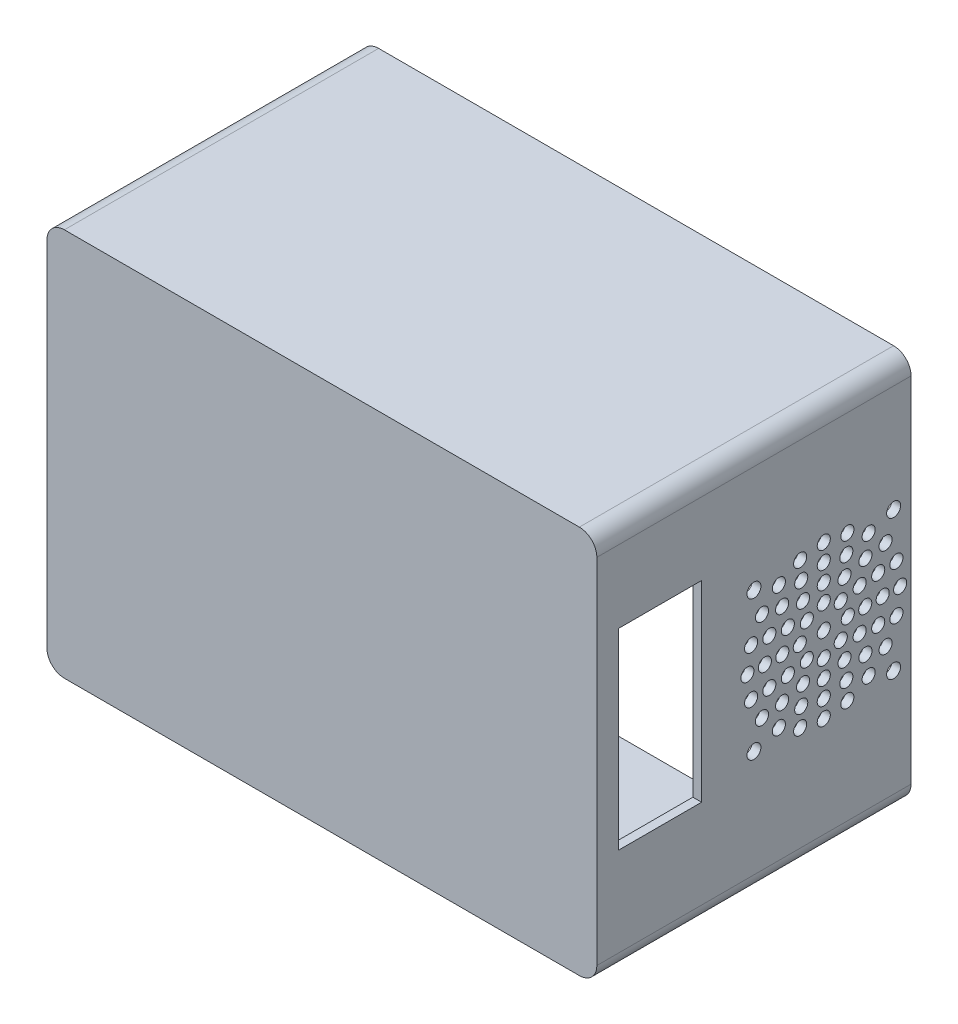
from build123d import *

# Parameters (mm, degrees)
SKETCH_1_W          = 126
SKETCH_1_H          = 89
SKETCH_1_R          = 2.15
SKETCH_1_R_2        = 2
EXTRUDE_4_DEPTH     = 70
SKETCH_3_W          = 126
SKETCH_3_H          = 89
EXTRUDE_5_DEPTH     = 2
SKETCH_4_R          = 1.6
SKETCH_4_R_2        = 1.5
CUT_EXTRUDE_1_DEPTH = 3
SKETCH_6_R          = 1.6
CUT_EXTRUDE_3_DEPTH = 2
SKETCH_8_W          = 110
SKETCH_8_H          = 22
CUT_EXTRUDE_4_DEPTH = 8
FILLET_3_R          = 4
SKETCH_9_W          = 19
SKETCH_9_H          = 44
CUT_EXTRUDE_5_DEPTH = 2
SKETCH_10_W         = 12
SKETCH_10_H         = 2
EXTRUDE_6_DEPTH     = 22


with BuildPart() as part:
    # 草图1 → 凸台-拉伸4 (new body)
    with BuildSketch(Plane.XY):
        Rectangle(SKETCH_1_W, SKETCH_1_H)
        Polygon((-4, 42.5), (-4, 36.5), (4, 36.5), (4, 42.5), (55, 42.5), (55, 36.5), (61, 36.5), (61, -36.5), (55, -36.5), (55, -42.5), (4, -42.5), (4, -36.5), (-4, -36.5), (-4, -42.5), (-55, -42.5), (-55, -36.5), (-61, -36.5), (-61, 36.5), (-55, 36.5), (-55, 42.5), align=None, mode=Mode.SUBTRACT)
        with Locations((0, 40.5)):
            Circle(SKETCH_1_R, mode=Mode.SUBTRACT)
        with Locations((-59, 40.5)):
            Circle(SKETCH_1_R, mode=Mode.SUBTRACT)
        with Locations((0, -40.5)):
            Circle(SKETCH_1_R, mode=Mode.SUBTRACT)
        with Locations((59, -40.5)):
            Circle(SKETCH_1_R, mode=Mode.SUBTRACT)
        with Locations((59, 40.5)):
            Circle(SKETCH_1_R, mode=Mode.SUBTRACT)
        with Locations((-59, -40.5)):
            Circle(SKETCH_1_R_2, mode=Mode.SUBTRACT)
    extrude(amount=EXTRUDE_4_DEPTH)

    # 草图3 → 凸台-拉伸5 (add)
    with BuildSketch(Plane.XY.offset(70)):
        Rectangle(SKETCH_3_W, SKETCH_3_H)
    extrude(amount=EXTRUDE_5_DEPTH)

    # 草图4 → 切除-拉伸1 (cut)
    with BuildSketch(Plane(origin=(63, 0, 0), x_dir=(0, 0, -1), z_dir=(1, 0, 0))):
        with Locations((-36, 16)):
            Circle(SKETCH_4_R)
        with Locations((-4, 16)):
            Circle(SKETCH_4_R)
        with Locations((-4, -16)):
            Circle(SKETCH_4_R)
        with Locations((-36, -16)):
            Circle(SKETCH_4_R)
        with Locations((-20, 17.5)):
            Circle(SKETCH_4_R_2)
        with Locations((-20, 0)):
            Circle(SKETCH_4_R_2)
        with Locations((-20, 9.5)):
            Circle(SKETCH_4_R_2)
        with Locations((-20, 13.5)):
            Circle(SKETCH_4_R_2)
        with Locations((-20, 5.5)):
            Circle(SKETCH_4_R_2)
        with Locations((-14.592202598, 16.643489035)):
            Circle(SKETCH_4_R_2)
        with Locations((-9.713758085, 14.157797402)):
            Circle(SKETCH_4_R_2)
        with Locations((-5.842202598, 10.286241915)):
            Circle(SKETCH_4_R_2)
        with Locations((-3.356510965, 5.407797402)):
            Circle(SKETCH_4_R_2)
        with Locations((-2.5, 0)):
            Circle(SKETCH_4_R_2)
        with Locations((-3.356510965, -5.407797402)):
            Circle(SKETCH_4_R_2)
        with Locations((-5.842202598, -10.286241915)):
            Circle(SKETCH_4_R_2)
        with Locations((-9.713758085, -14.157797402)):
            Circle(SKETCH_4_R_2)
        with Locations((-14.592202598, -16.643489035)):
            Circle(SKETCH_4_R_2)
        with Locations((-20, -17.5)):
            Circle(SKETCH_4_R_2)
        with Locations((-25.407797402, -16.643489035)):
            Circle(SKETCH_4_R_2)
        with Locations((-30.286241915, -14.157797402)):
            Circle(SKETCH_4_R_2)
        with Locations((-34.157797402, -10.286241915)):
            Circle(SKETCH_4_R_2)
        with Locations((-36.643489035, -5.407797402)):
            Circle(SKETCH_4_R_2)
        with Locations((-37.5, 0)):
            Circle(SKETCH_4_R_2)
        with Locations((-36.643489035, 5.407797402)):
            Circle(SKETCH_4_R_2)
        with Locations((-34.157797402, 10.286241915)):
            Circle(SKETCH_4_R_2)
        with Locations((-30.286241915, 14.157797402)):
            Circle(SKETCH_4_R_2)
        with Locations((-25.407797402, 16.643489035)):
            Circle(SKETCH_4_R_2)
        with Locations((-14.833773663, 12.472373689)):
            Circle(SKETCH_4_R_2)
        with Locations((-10.454058454, 9.545941546)):
            Circle(SKETCH_4_R_2)
        with Locations((-7.527626311, 5.166226337)):
            Circle(SKETCH_4_R_2)
        with Locations((-6.5, 0)):
            Circle(SKETCH_4_R_2)
        with Locations((-7.527626311, -5.166226337)):
            Circle(SKETCH_4_R_2)
        with Locations((-10.454058454, -9.545941546)):
            Circle(SKETCH_4_R_2)
        with Locations((-14.833773663, -12.472373689)):
            Circle(SKETCH_4_R_2)
        with Locations((-20, -13.5)):
            Circle(SKETCH_4_R_2)
        with Locations((-25.166226337, -12.472373689)):
            Circle(SKETCH_4_R_2)
        with Locations((-29.545941546, -9.545941546)):
            Circle(SKETCH_4_R_2)
        with Locations((-32.472373689, -5.166226337)):
            Circle(SKETCH_4_R_2)
        with Locations((-33.5, 0)):
            Circle(SKETCH_4_R_2)
        with Locations((-32.472373689, 5.166226337)):
            Circle(SKETCH_4_R_2)
        with Locations((-29.545941546, 9.545941546)):
            Circle(SKETCH_4_R_2)
        with Locations((-25.166226337, 12.472373689)):
            Circle(SKETCH_4_R_2)
        with Locations((-15.25, 8.227241336)):
            Circle(SKETCH_4_R_2)
        with Locations((-11.772758664, 4.75)):
            Circle(SKETCH_4_R_2)
        with Locations((-10.5, 0)):
            Circle(SKETCH_4_R_2)
        with Locations((-11.772758664, -4.75)):
            Circle(SKETCH_4_R_2)
        with Locations((-15.25, -8.227241336)):
            Circle(SKETCH_4_R_2)
        with Locations((-20, -9.5)):
            Circle(SKETCH_4_R_2)
        with Locations((-24.75, -8.227241336)):
            Circle(SKETCH_4_R_2)
        with Locations((-28.227241336, -4.75)):
            Circle(SKETCH_4_R_2)
        with Locations((-29.5, 0)):
            Circle(SKETCH_4_R_2)
        with Locations((-28.227241336, 4.75)):
            Circle(SKETCH_4_R_2)
        with Locations((-24.75, 8.227241336)):
            Circle(SKETCH_4_R_2)
        with Locations((-16.110912703, 3.889087297)):
            Circle(SKETCH_4_R_2)
        with Locations((-14.5, 0)):
            Circle(SKETCH_4_R_2)
        with Locations((-16.110912703, -3.889087297)):
            Circle(SKETCH_4_R_2)
        with Locations((-20, -5.5)):
            Circle(SKETCH_4_R_2)
        with Locations((-23.889087297, -3.889087297)):
            Circle(SKETCH_4_R_2)
        with Locations((-25.5, 0)):
            Circle(SKETCH_4_R_2)
        with Locations((-23.889087297, 3.889087297)):
            Circle(SKETCH_4_R_2)
    extrude(amount=-CUT_EXTRUDE_1_DEPTH, mode=Mode.SUBTRACT)

    # 草图6 → 切除-拉伸3 (cut)
    with BuildSketch(Plane.ZY.offset(63)):
        with Locations((10, 34.5)):
            Circle(SKETCH_6_R)
        with Locations((20, 34.5)):
            Circle(SKETCH_6_R)
        with Locations((30, 34.5)):
            Circle(SKETCH_6_R)
        with Locations((20, 26)):
            Circle(SKETCH_6_R)
        with Locations((30, 26)):
            Circle(SKETCH_6_R)
        with Locations((20, 17.5)):
            Circle(SKETCH_6_R)
        with Locations((30, 17.5)):
            Circle(SKETCH_6_R)
        with Locations((20, 9)):
            Circle(SKETCH_6_R)
        with Locations((30, 9)):
            Circle(SKETCH_6_R)
        with Locations((20, 0.5)):
            Circle(SKETCH_6_R)
        with Locations((30, 0.5)):
            Circle(SKETCH_6_R)
        with Locations((20, -8)):
            Circle(SKETCH_6_R)
        with Locations((30, -8)):
            Circle(SKETCH_6_R)
        with Locations((20, -16.5)):
            Circle(SKETCH_6_R)
        with Locations((30, -16.5)):
            Circle(SKETCH_6_R)
        with Locations((20, -25)):
            Circle(SKETCH_6_R)
        with Locations((30, -25)):
            Circle(SKETCH_6_R)
        with Locations((20, -33.5)):
            Circle(SKETCH_6_R)
        with Locations((30, -33.5)):
            Circle(SKETCH_6_R)
        with Locations((10, 26)):
            Circle(SKETCH_6_R)
        with Locations((10, 17.5)):
            Circle(SKETCH_6_R)
        with Locations((10, 9)):
            Circle(SKETCH_6_R)
        with Locations((10, 0.5)):
            Circle(SKETCH_6_R)
        with Locations((10, -8)):
            Circle(SKETCH_6_R)
        with Locations((10, -16.5)):
            Circle(SKETCH_6_R)
        with Locations((10, -25)):
            Circle(SKETCH_6_R)
        with Locations((10, -33.5)):
            Circle(SKETCH_6_R)
    extrude(amount=-CUT_EXTRUDE_3_DEPTH, mode=Mode.SUBTRACT)

    # 草图8 → 切除-拉伸4 (cut)
    with BuildSketch(Plane.XZ.offset(44.5)):
        with Locations((0, 11)):
            Rectangle(SKETCH_8_W, SKETCH_8_H)
    extrude(amount=-CUT_EXTRUDE_4_DEPTH, mode=Mode.SUBTRACT)

    # 圆角3
    fillet_3_edges = [part.edges().sort_by_distance(p)[0] for p in [
        (-55, 36.5, 35),
        (-55, -36.5, 35),
        (-63, 44.5, 36),
        (-63, -44.5, 36),
        (4, -36.5, 46),
        (-4, -36.5, 46),
        (4, 36.5, 35),
        (-4, 36.5, 35),
        (55, -36.5, 35),
        (63, -44.5, 36),
        (63, 44.5, 36),
        (55, 36.5, 35),
    ]]
    fillet(fillet_3_edges, radius=FILLET_3_R - 0.0001)  # a hair under: the kernel refuses the full size

    # 草图9 → 切除-拉伸5 (cut)
    with BuildSketch(Plane.ZY.offset(-61)):
        with Locations((57.5, 1.907407407)):
            Rectangle(SKETCH_9_W, SKETCH_9_H)
    extrude(amount=-CUT_EXTRUDE_5_DEPTH, mode=Mode.SUBTRACT)

    # 草图10 → 凸台-拉伸6 (add)
    with BuildSketch(Plane(origin=(0, 0, 22), x_dir=(-1, 0, 0), z_dir=(0, 0, -1))):
        with Locations((-49, -43.5)):
            Rectangle(SKETCH_10_W, SKETCH_10_H)
    extrude(amount=EXTRUDE_6_DEPTH)


solid = part.part
